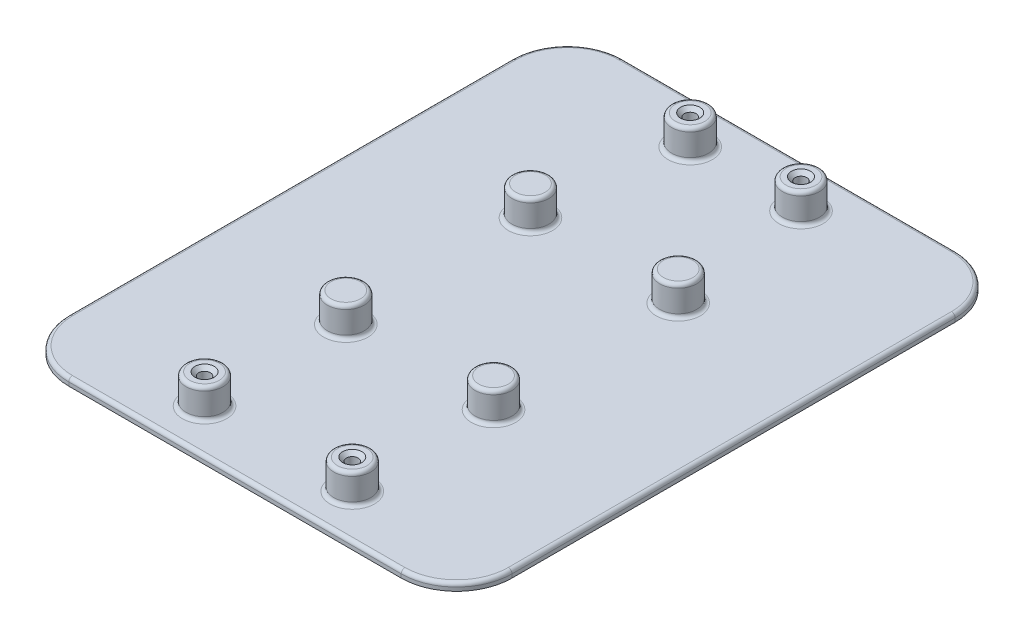
from build123d import *

# Parameters (mm, degrees)
BOSS_EXTRUDE1_DEPTH = 2
SKETCH2_R           = 5
SKETCH2_R_2         = 1.5875
BOSS_EXTRUDE2_DEPTH = 8
FILLET1_R           = 1
CHAMFER1_SIZE       = 1


with BuildPart() as part:
    # Sketch1 → Boss-Extrude1 (new body)
    with BuildSketch(Plane(origin=(0, 0, 0), x_dir=(1, 0, 0), z_dir=(0, 1, 0))):
        with BuildLine():
            Line((15, 0), (105, 0))
            ThreePointArc((105, 0), (115.606601718, 4.393398282), (120, 15))
            Line((120, 15), (120, 135))
            ThreePointArc((120, 135), (115.606601718, 145.606601718), (105, 150))
            Line((105, 150), (15, 150))
            ThreePointArc((15, 150), (4.393398282, 145.606601718), (0, 135))
            Line((0, 135), (0, 15))
            ThreePointArc((0, 15), (4.393398282, 4.393398282), (15, 0))
        make_face()
    extrude(amount=BOSS_EXTRUDE1_DEPTH)

    # Sketch2 → Boss-Extrude2 (add)
    # profile 1 of 8: a face of its own
    with BuildSketch(Plane(origin=(0, 2, 0), x_dir=(1, 0, 0), z_dir=(0, 1, 0))):
        with Locations((45, 138.25)):
            Circle(SKETCH2_R)
        with Locations((45, 138.25)):
            Circle(SKETCH2_R_2, mode=Mode.SUBTRACT)
    # profile 2 of 8: a face of its own
    with BuildSketch(Plane(origin=(0, 2, 0), x_dir=(1, 0, 0), z_dir=(0, 1, 0))):
        with Locations((75, 138.25)):
            Circle(SKETCH2_R)
        with Locations((75, 138.25)):
            Circle(SKETCH2_R_2, mode=Mode.SUBTRACT)
    # profile 3 of 8: a face of its own
    with BuildSketch(Plane(origin=(0, 2, 0), x_dir=(1, 0, 0), z_dir=(0, 1, 0))):
        with Locations((40, 11.75)):
            Circle(SKETCH2_R)
        with Locations((40, 11.75)):
            Circle(SKETCH2_R_2, mode=Mode.SUBTRACT)
    # profile 4 of 8: a face of its own
    with BuildSketch(Plane(origin=(0, 2, 0), x_dir=(1, 0, 0), z_dir=(0, 1, 0))):
        with Locations((80, 11.75)):
            Circle(SKETCH2_R)
        with Locations((80, 11.75)):
            Circle(SKETCH2_R_2, mode=Mode.SUBTRACT)
    # profile 5 of 8: a face of its own
    with BuildSketch(Plane(origin=(0, 2, 0), x_dir=(1, 0, 0), z_dir=(0, 1, 0))):
        with Locations((40, 50)):
            Circle(SKETCH2_R)
    # profile 6 of 8: a face of its own
    with BuildSketch(Plane(origin=(0, 2, 0), x_dir=(1, 0, 0), z_dir=(0, 1, 0))):
        with Locations((80, 50)):
            Circle(SKETCH2_R)
    # profile 7 of 8: a face of its own
    with BuildSketch(Plane(origin=(0, 2, 0), x_dir=(1, 0, 0), z_dir=(0, 1, 0))):
        with Locations((40, 100)):
            Circle(SKETCH2_R)
    # profile 8 of 8: a face of its own
    with BuildSketch(Plane(origin=(0, 2, 0), x_dir=(1, 0, 0), z_dir=(0, 1, 0))):
        with Locations((80, 100)):
            Circle(SKETCH2_R)
    extrude(amount=BOSS_EXTRUDE2_DEPTH)

    # Fillet1
    fillet1_edges = [part.edges().sort_by_distance(p)[0] for p in [
        (0, 2, -75),
        (4.393398282, 2, -145.606601718),
        (60, 2, -150),
        (115.606601718, 2, -145.606601718),
        (120, 2, -75),
        (115.606601718, 2, -4.393398282),
        (60, 2, 0),
        (70, 10, -138.25),
        (40, 10, -138.25),
        (75, 10, -11.75),
        (35, 10, -11.75),
        (4.393398282, 2, -4.393398282),
        (75, 2, -11.75),
        (35, 2, -11.75),
        (70, 2, -138.25),
        (40, 2, -138.25),
        (75, 10, -100),
        (35, 10, -50),
        (75, 10, -50),
        (35, 10, -100),
        (75, 2, -50),
        (35, 2, -100),
        (35, 2, -50),
        (75, 2, -100),
    ]]
    fillet(fillet1_edges, radius=FILLET1_R)

    # Chamfer1
    chamfer1_edges = [part.edges().sort_by_distance(p)[0] for p in [
        (78.4125, 10, -11.75),
        (38.4125, 10, -11.75),
        (73.4125, 10, -138.25),
        (43.4125, 10, -138.25),
    ]]
    chamfer(chamfer1_edges, length=CHAMFER1_SIZE)


solid = part.part
